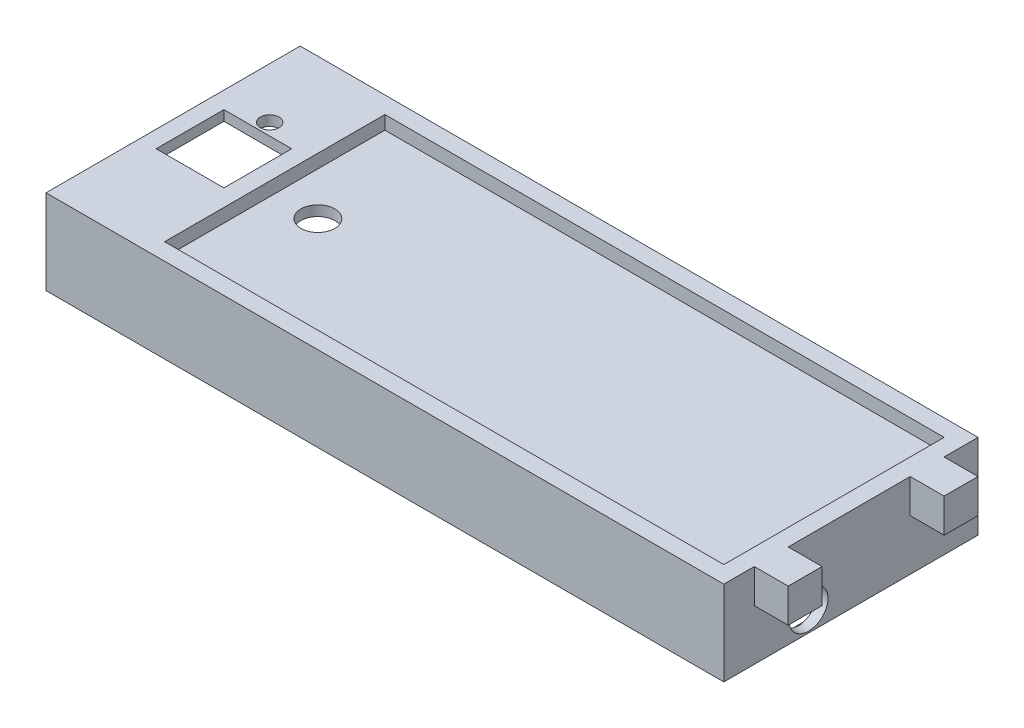
from build123d import *

# Parameters (mm, degrees)
SKETCH1_W           = 200
SKETCH1_H           = 75
BOSS_EXTRUDE1_DEPTH = 25
SKETCH9_W           = 165
SKETCH9_H           = 65
CUT_EXTRUDE5_DEPTH  = 4
SHELL3_START        = -34.5
SHELL3_DEPTH        = 69
SKETCH14_W          = 10
SKETCH14_H          = 10
BOSS_EXTRUDE5_DEPTH = 10
SKETCH15_R          = 5
CUT_EXTRUDE7_DEPTH  = 157.036053526
SKETCH16_W          = 20
SKETCH16_H          = 20
CUT_EXTRUDE8_DEPTH  = 157.624551077
SKETCH19_RX         = 5.75
SKETCH19_RY         = 5.5
SKETCH21_R          = 2.75
CUT_EXTRUDE9_DEPTH  = 157.624551117


# Read off the part's stored shape, not the designer's step: Shell3
with BuildPart() as part:
    # Sketch1 → Boss-Extrude1 (new body)
    with BuildSketch(Plane(origin=(0, 0, 0), x_dir=(1, 0, 0), z_dir=(0, 1, 0))):
        with Locations((40, 0)):
            Rectangle(SKETCH1_W, SKETCH1_H)
    extrude(amount=BOSS_EXTRUDE1_DEPTH)

    # Sketch9 → Cut-Extrude5 (cut)
    with BuildSketch(Plane(origin=(0, 25, 0), x_dir=(1, 0, 0), z_dir=(0, 1, 0))):
        with Locations((52.5, 0)):
            Rectangle(SKETCH9_W, SKETCH9_H)
    extrude(amount=-CUT_EXTRUDE5_DEPTH, mode=Mode.SUBTRACT)

    # Shell3 outline → Shell3 (cut)
    with BuildSketch(Plane.XY.offset(SHELL3_START)):
        Polygon((137, 0), (137, 18), (-33, 18), (-33, 22), (-60, 22), (-60, 0), align=None)
    extrude(amount=SHELL3_DEPTH, mode=Mode.SUBTRACT)

    # Sketch14 → Boss-Extrude5 (add)
    with BuildSketch(Plane(origin=(140, 0, 0), x_dir=(0, 0, -1), z_dir=(1, 0, 0))):
        with Locations((-23.5, 20)):
            Rectangle(SKETCH14_W, SKETCH14_H)
        with Locations((22.5, 20)):
            Rectangle(SKETCH14_W, SKETCH14_H)
    extrude(amount=BOSS_EXTRUDE5_DEPTH)

    # Sketch15 → Cut-Extrude7 (cut, through all)
    with BuildSketch(Plane(origin=(0, 21, 0), x_dir=(1, 0, 0), z_dir=(0, 1, 0))):
        with Locations(Location((-17.28231035, 0, 0), (0, 0, 270))):
            Circle(SKETCH15_R)
    extrude(amount=-CUT_EXTRUDE7_DEPTH, mode=Mode.SUBTRACT)

    # Sketch16 → Cut-Extrude8 (cut, through all)
    with BuildSketch(Plane(origin=(0, 25, 0), x_dir=(1, 0, 0), z_dir=(0, 1, 0))):
        with Locations((-45, 0)):
            Rectangle(SKETCH16_W, SKETCH16_H)
    extrude(amount=-CUT_EXTRUDE8_DEPTH, mode=Mode.SUBTRACT)

    # Cut-Sweep2: sweep along a path in Sketch20
    with BuildLine() as cut_sweep2_path:  # in the path sketch's own coordinates; laid on its plane below (add() does not lay a ready-made edge on the line's plane)
        add(Edge.make_bspline(
            [(-140, 6), (-136.19888528, 6.630281352), (-133.075750061, 4.182881523)],
            knots=[0, 0, 0, 1, 1, 1], degree=2))
    # Sketch19 → Cut-Sweep2 (sweep, cut)
    with BuildSketch(Plane(origin=(140, 0, 0), x_dir=(0, 0, -1), z_dir=(1, 0, 0))):
        with Locations(Location((-12.5, 6), (0, 0, 0))):
            Ellipse(SKETCH19_RX, SKETCH19_RY)
    sweep(path=Plane(origin=(0, 0, 0), x_dir=(-1, 0, 0), z_dir=(0, 0, -1)) * cut_sweep2_path.line, mode=Mode.SUBTRACT)

    # Sketch21 → Cut-Extrude9 (cut, through all)
    with BuildSketch(Plane(origin=(0, 25, 0), x_dir=(1, 0, 0), z_dir=(0, 1, 0))):
        with Locations(Location((-45, 13.5, 0), (0, 0, 270))):
            Circle(SKETCH21_R)
    extrude(amount=-CUT_EXTRUDE9_DEPTH, mode=Mode.SUBTRACT)


solid = part.part
